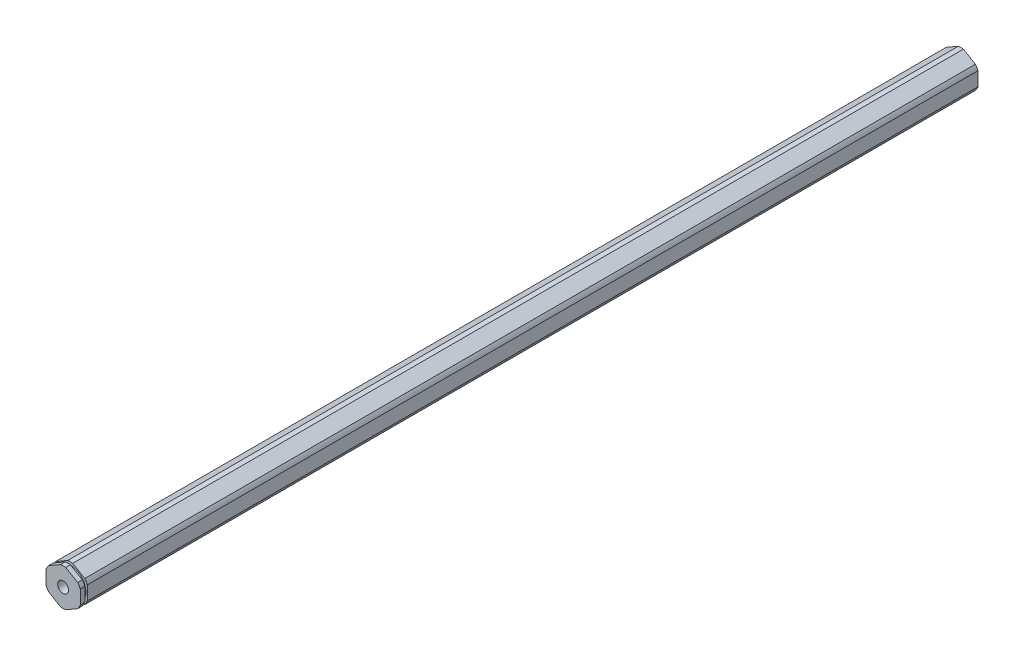
from build123d import *

# Parameters (mm, degrees)
BOSS_EXTRUDE1_DEPTH                  = 166.40175
F_10_32_TAPPED_HOLE1_D               = 4.0386
F_10_32_TAPPED_HOLE1_DEPTH           = 16.34744
F_10_32_TAPPED_HOLE1_TIP             = 1.213317848
F_10_32_TAPPED_HOLE1_ON_FACE_2_D     = 4.0386
F_10_32_TAPPED_HOLE1_ON_FACE_2_DEPTH = 16.34744
F_10_32_TAPPED_HOLE1_ON_FACE_2_TIP   = 1.213317848
SKETCH5_W                            = 0.889
SKETCH5_H                            = 1.0033


with BuildPart() as part:
    # Sketch1 → Boss-Extrude1 (new, symmetric)
    with BuildSketch(Plane.XY):
        with BuildLine():
            ThreePointArc((0.93173274, 6.79441227), (0, 6.858), (-0.93173274, 6.79441227))
            Line((-0.93173274, 6.79441227), (-5.41826726, 4.204110358))
            ThreePointArc((-5.41826726, 4.204110358), (-5.939202219, 3.429), (-6.35, 2.590301913))
            Line((-6.35, 2.590301913), (-6.35, -2.590301913))
            ThreePointArc((-6.35, -2.590301913), (-5.939202219, -3.429), (-5.41826726, -4.204110358))
            Line((-5.41826726, -4.204110358), (-0.93173274, -6.79441227))
            ThreePointArc((-0.93173274, -6.79441227), (0, -6.858), (0.93173274, -6.79441227))
            Line((0.93173274, -6.79441227), (5.41826726, -4.204110358))
            ThreePointArc((5.41826726, -4.204110358), (5.939202219, -3.429), (6.35, -2.590301913))
            Line((6.35, -2.590301913), (6.35, 2.590301913))
            ThreePointArc((6.35, 2.590301913), (5.939202219, 3.429), (5.41826726, 4.204110358))
            Line((5.41826726, 4.204110358), (0.93173274, 6.79441227))
        make_face()
    extrude(amount=BOSS_EXTRUDE1_DEPTH, both=True)

    # #10-32 Tapped Hole1
    with Locations(Plane.XY.offset(166.40175)):
        with Locations((0, 0)):
            Hole(F_10_32_TAPPED_HOLE1_D / 2, depth=F_10_32_TAPPED_HOLE1_DEPTH)
            with Locations((0, 0, -(F_10_32_TAPPED_HOLE1_DEPTH + F_10_32_TAPPED_HOLE1_TIP / 2))):  # 118° drill point
                Cone(0, F_10_32_TAPPED_HOLE1_D / 2, F_10_32_TAPPED_HOLE1_TIP, mode=Mode.SUBTRACT)

    # #10-32 Tapped Hole1 on face 2
    with Locations(Plane(origin=(0, 0, -166.40175), x_dir=(-1, 0, 0), z_dir=(0, 0, -1))):
        with Locations((0, 0)):
            Hole(F_10_32_TAPPED_HOLE1_ON_FACE_2_D / 2, depth=F_10_32_TAPPED_HOLE1_ON_FACE_2_DEPTH)
            with Locations((0, 0, -(F_10_32_TAPPED_HOLE1_ON_FACE_2_DEPTH + F_10_32_TAPPED_HOLE1_ON_FACE_2_TIP / 2))):  # 118° drill point
                Cone(0, F_10_32_TAPPED_HOLE1_ON_FACE_2_D / 2, F_10_32_TAPPED_HOLE1_ON_FACE_2_TIP, mode=Mode.SUBTRACT)

    # Sketch5 → Cut-Revolve1 (revolve, cut)
    with BuildSketch(Plane(origin=(0, 0, 0), x_dir=(0, 0, -1), z_dir=(1, 0, 0))):
        with Locations((-164.24275, 6.35635)):
            Rectangle(SKETCH5_W, SKETCH5_H)
    revolve(axis=Axis((0, 0, 165.047176272), (0, 0, -1)), mode=Mode.SUBTRACT)


solid = part.part
